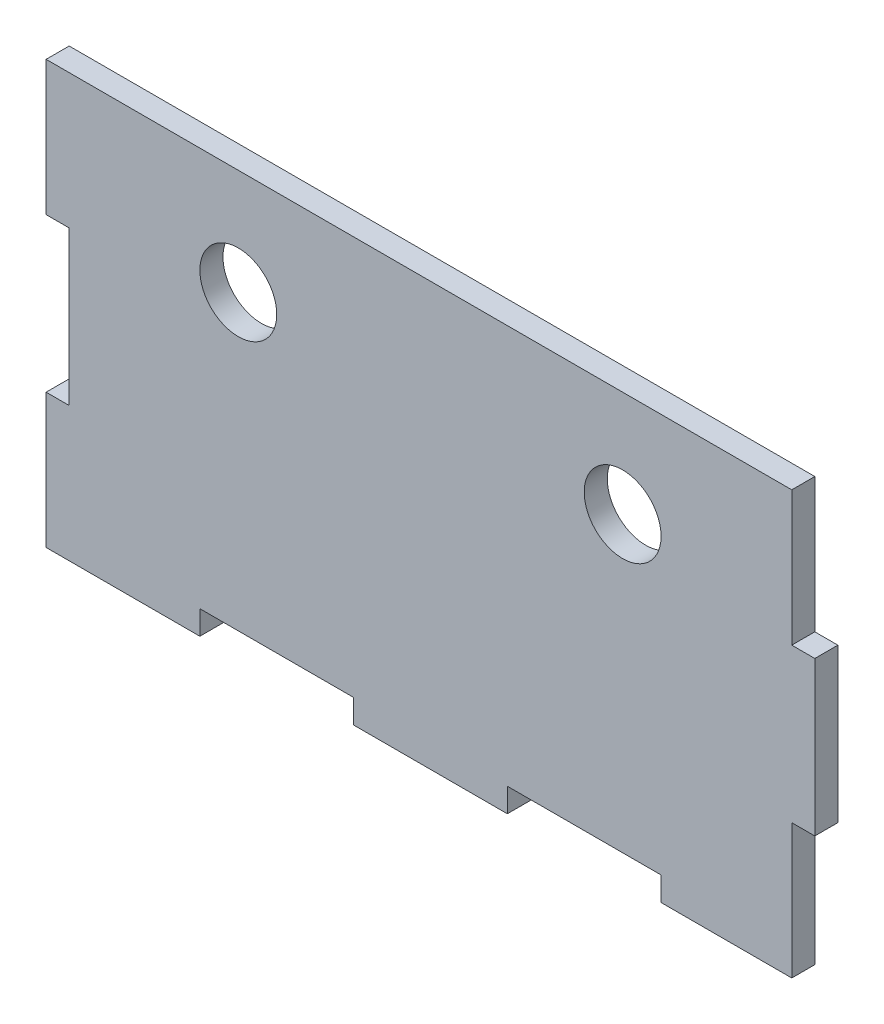
from build123d import *

# Parameters (mm, degrees)
SKETCH1_R           = 5
BOSS_EXTRUDE1_DEPTH = 3


with BuildPart() as part:
    # Sketch1 → Boss-Extrude1 (new body)
    with BuildSketch(Plane.XY):
        Polygon((-50, -10), (-50, -27.5), (-30, -27.5), (-30, -24.393503037), (-10, -24.393503037), (-10, -27.5), (10, -27.5), (10, -24.393503037), (30, -24.393503037), (30, -27.5), (47, -27.5), (47, -10), (50, -10), (50, 10), (47, 10), (47, 27.5), (-50, 27.5), (-50, 10), (-47, 10), (-47, -10), align=None)
        with Locations((-25, 13.75)):
            Circle(SKETCH1_R, mode=Mode.SUBTRACT)
        with Locations((25, 13.75)):
            Circle(SKETCH1_R, mode=Mode.SUBTRACT)
    extrude(amount=BOSS_EXTRUDE1_DEPTH)


solid = part.part
